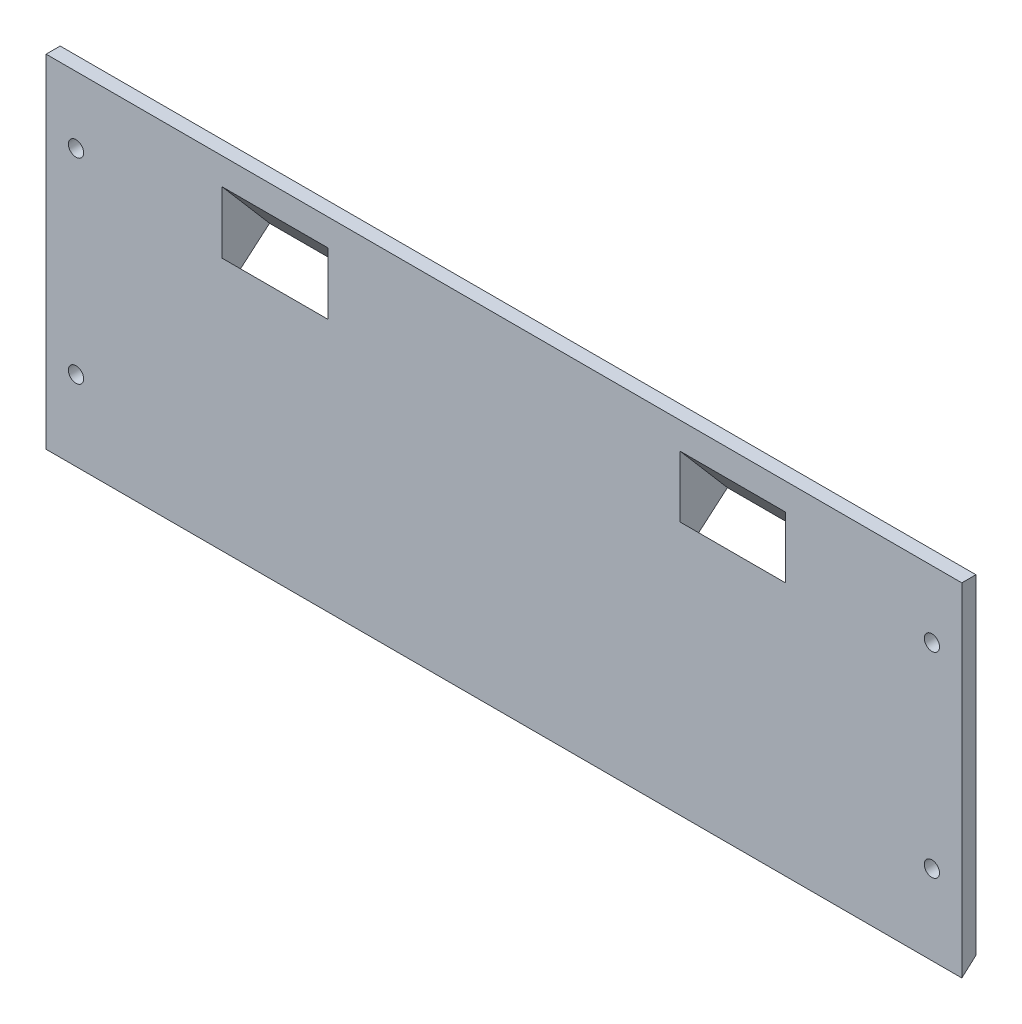
from build123d import *

# Parameters (mm, degrees)
CROQUIS1_W                  = 195
CROQUIS1_H                  = 38
CROQUIS1_R                  = 1.625
SALIENTE_EXTRUIR1_DEPTH     = 3
CROQUIS8_W                  = 195
CROQUIS8_H                  = 3
SALIENTE_EXTRUIR5_DEPTH     = 5
CROQUIS9_W                  = 195
CROQUIS9_H                  = 3
SALIENTE_EXTRUIR6_DEPTH     = 5
SALIENTE_EXTRUIR7_START     = -35
SALIENTE_EXTRUIR7_DEPTH     = 35
CORTAR_EXTRUIR4_DEPTH       = 106.249773968
CORTAR_EXTRUIR4_DEPTH_BACK  = 106.249773968
CROQUIS11_W                 = 22.5
CROQUIS11_H                 = 8.5
CORTAR_EXTRUIR5_REACH       = 168.049
CROQUIS13_R                 = 1
CORTAR_EXTRUIR6_DEPTH       = 5
SALIENTE_EXTRUIR8_START     = -35
SALIENTE_EXTRUIR8_DEPTH     = 35
CORTAR_EXTRUIR7_DEPTH       = 105.027363957
CORTAR_EXTRUIR7_DEPTH_BACK  = 105.027363957
CROQUIS16_W                 = 22.5
CROQUIS16_H                 = 8.572274099
CROQUIS17_R                 = 1
CORTAR_EXTRUIR8_DEPTH       = 5
CROQUIS18_R                 = 1.625
CORTAR_EXTRUIR9_DEPTH       = 10
CROQUIS19_W                 = 195
CROQUIS19_H                 = 24
SALIENTE_EXTRUIR9_DEPTH     = 3
CROQUIS20_W                 = 195
CROQUIS20_H                 = 28.69
SALIENTE_EXTRUIR10_DEPTH    = 3
CROQUIS22_W                 = 195
CROQUIS22_H                 = 8.799275258
CROQUIS22_W_2               = 10.817472397
CROQUIS22_H_2               = 9.408992843
CROQUIS22_W_3               = 11.057059306
SALIENTE_EXTRUIR11_DEPTH    = 3
CROQUIS23_R                 = 1.625
CORTAR_EXTRUIR10_DEPTH      = 10
CORTAR_EXTRUIR11_DEPTH      = 202.915168907
CORTAR_EXTRUIR11_DEPTH_BACK = 202.915168907
CROQUIS25_W                 = 6.04831912
CROQUIS25_H                 = 14.575165693
SALIENTE_EXTRUIR12_START    = -65
SALIENTE_EXTRUIR12_DEPTH    = 65
SALIENTE_EXTRUIR15_DEPTH    = 12.75
SALIENTE_EXTRUIR16_DEPTH    = 12.75
CROQUIS27_W                 = 3
CROQUIS27_H                 = 30
SALIENTE_EXTRUIR13_DEPTH    = 195
SALIENTE_EXTRUIR14_DEPTH    = 195
CORTAR_EXTRUIR12_DEPTH      = 127.00662353
CORTAR_EXTRUIR12_DEPTH_BACK = 127.00662353
CROQUIS31_R                 = 1.625
SALIENTE_EXTRUIR17_DEPTH    = 12.75
SALIENTE_EXTRUIR18_DEPTH    = 12.75
CORTAR_EXTRUIR15_DEPTH      = 125.603100021
CORTAR_EXTRUIR15_DEPTH_BACK = 125.603100021
CROQUIS39_R                 = 1.625
CORTAR_EXTRUIR16_START      = -4
CROQUIS40_R                 = 4
CORTAR_EXTRUIR16_DEPTH      = 121.603100021
SALIENTE_EXTRUIR19_START    = -15
SALIENTE_EXTRUIR19_DEPTH    = 4
CHAFL_N1_SIZE               = 10
CORTAR_EXTRUIR17_DEPTH      = 213.001339527
CORTAR_EXTRUIR17_DEPTH_BACK = 213.001339527
CROQUIS45_W                 = 3
CROQUIS45_H                 = 8.799275258
CORTAR_EXTRUIR18_DEPTH      = 202.915168907


with BuildPart() as part:
    # Croquis1 → Saliente-Extruir1 (new body)
    with BuildSketch(Plane.XY):
        with Locations((0, 19)):
            Rectangle(CROQUIS1_W, CROQUIS1_H)
        with Locations((91.125, 15)):
            Circle(CROQUIS1_R, mode=Mode.SUBTRACT)
        with Locations(Location((-91.125, 15, 0), (0, 0, 180))):
            Circle(CROQUIS1_R, mode=Mode.SUBTRACT)
    extrude(amount=SALIENTE_EXTRUIR1_DEPTH)

    # Croquis8 → Saliente-Extruir5 (add)
    with BuildSketch(Plane.XZ):
        with Locations((0, 1.5)):
            Rectangle(CROQUIS8_W, CROQUIS8_H)
    extrude(amount=SALIENTE_EXTRUIR5_DEPTH)

    # Croquis9 → Saliente-Extruir6 (add)
    with BuildSketch(Plane(origin=(0, 38, 0), x_dir=(1, 0, 0), z_dir=(0, 1, 0))):
        with Locations((0, -1.5)):
            Rectangle(CROQUIS9_W, CROQUIS9_H)
    extrude(amount=SALIENTE_EXTRUIR6_DEPTH)

    # Croquis10 → Saliente-Extruir7 (add)
    with BuildSketch(Plane(origin=(97.5, 0, 0), x_dir=(0, 0, -1), z_dir=(1, 0, 0)).offset(SALIENTE_EXTRUIR7_START)):
        Polygon((0, 35.316843742), (11.100559408, 22.365598856), (1.230032412, 13.905534031), (0, 12.851268747), align=None)
    extrude(amount=-SALIENTE_EXTRUIR7_DEPTH)

    # Croquis11 → Cortar-Extruir4 (cut, two sides: drawn at the far end of the back side and taken through both)
    with BuildSketch(Plane(origin=(0, 7.408665422, 6.349994257), x_dir=(1, 0, 0), z_dir=(0, -0.7592713073348797, -0.6507742172658522)).offset(-CORTAR_EXTRUIR4_DEPTH_BACK)):
        with Locations((48.75, -17.733291342)):
            Rectangle(CROQUIS11_W, CROQUIS11_H)
    extrude(amount=CORTAR_EXTRUIR4_DEPTH + CORTAR_EXTRUIR4_DEPTH_BACK, mode=Mode.SUBTRACT)

    # Croquis12 → Cortar-Extruir5 (cut, up to next)
    with BuildSketch(Plane(origin=(62.5, 0, 0), x_dir=(0, 0, -1), z_dir=(1, 0, 0)), mode=Mode.PRIVATE) as cortar_extruir5_sk1:
        Polygon((11.100559408, 22.365598856), (0, 12.851268747), (0, 19.436530105), (7.846688321, 26.161955392), align=None)
    cortar_extruir5_tool1 = extrude(cortar_extruir5_sk1.sketch, amount=-CORTAR_EXTRUIR5_REACH, mode=Mode.PRIVATE) & part.part
    add(cortar_extruir5_tool1.solids().sort_by_distance((62.5, 20.055266, -4.783378))[0], mode=Mode.SUBTRACT)

    # Croquis13 → Cortar-Extruir6 (cut)
    with BuildSketch(Plane(origin=(0, 11.205021959, 9.603865343), x_dir=(1, 0, 0), z_dir=(0, -0.7592713073348788, -0.6507742172658535))):
        with Locations(Location((33.75, -17.823291342, 0), (0, 0, 270))):
            Circle(CROQUIS13_R)
    extrude(amount=-CORTAR_EXTRUIR6_DEPTH, mode=Mode.SUBTRACT)

    # Croquis14 → Saliente-Extruir8 (add)
    with BuildSketch(Plane.ZY.offset(97.5).offset(SALIENTE_EXTRUIR8_START)):
        Polygon((0, 19.436530105), (-7.846688321, 26.161955392), (0, 35.316843742), align=None)
    extrude(amount=-SALIENTE_EXTRUIR8_DEPTH)

    # Croquis16 → Cortar-Extruir7 (cut, two sides: drawn at the far end of the back side and taken through both)
    with BuildSketch(Plane(origin=(0, 11.205021959, 9.603865343), x_dir=(1, 0, 0), z_dir=(0, -0.7592713073348788, -0.6507742172658535)).offset(-CORTAR_EXTRUIR7_DEPTH_BACK)):
        with Locations((-48.75, -17.697154293)):
            Rectangle(CROQUIS16_W, CROQUIS16_H)
    extrude(amount=CORTAR_EXTRUIR7_DEPTH + CORTAR_EXTRUIR7_DEPTH_BACK, mode=Mode.SUBTRACT)

    # Croquis17 → Cortar-Extruir8 (cut)
    with BuildSketch(Plane(origin=(0, 11.205021959, 9.603865343), x_dir=(1, 0, 0), z_dir=(0, -0.7592713073348788, -0.6507742172658535))):
        with Locations(Location((-33.75, -17.823291342, 0), (0, 0, 90))):
            Circle(CROQUIS17_R)
    extrude(amount=-CORTAR_EXTRUIR8_DEPTH, mode=Mode.SUBTRACT)

    # Croquis18 → Cortar-Extruir9 (cut)
    with BuildSketch(Plane.XY.offset(3)):
        with Locations((91.125, 23)):
            Circle(CROQUIS18_R)
        with Locations((-91.125, 23)):
            Circle(CROQUIS18_R)
    extrude(amount=-CORTAR_EXTRUIR9_DEPTH, mode=Mode.SUBTRACT)

    # Croquis19 → Saliente-Extruir9 (add)
    with BuildSketch(Plane.XY.offset(3)):
        with Locations((0, 7)):
            Rectangle(CROQUIS19_W, CROQUIS19_H)
    extrude(amount=-SALIENTE_EXTRUIR9_DEPTH)

    # Croquis20 → Saliente-Extruir10 (add)
    with BuildSketch(Plane.XY.offset(3)):
        with Locations((0, -19.345)):
            Rectangle(CROQUIS20_W, CROQUIS20_H)
    extrude(amount=-SALIENTE_EXTRUIR10_DEPTH)

    # Croquis22 → Saliente-Extruir11 (add)
    with BuildSketch(Plane.XY.offset(3)):
        with Locations((0, 47.399637629)):
            Rectangle(CROQUIS22_W, CROQUIS22_H)
        with Locations((-92.091263802, 22.840486177)):
            Rectangle(CROQUIS22_W_2, CROQUIS22_H_2)
        with Locations((91.971470347, 22.840486177)):
            Rectangle(CROQUIS22_W_3, CROQUIS22_H_2)
    extrude(amount=-SALIENTE_EXTRUIR11_DEPTH)

    # Croquis23 → Cortar-Extruir10 (cut)
    with BuildSketch(Plane.XY.offset(3)):
        with Locations((-91.125, 28.799275258)):
            Circle(CROQUIS23_R)
        with Locations((-91.125, -12.890724742)):
            Circle(CROQUIS23_R)
        with Locations((91.125, -12.890724742)):
            Circle(CROQUIS23_R)
        with Locations((91.125, 28.799275258)):
            Circle(CROQUIS23_R)
    extrude(amount=-CORTAR_EXTRUIR10_DEPTH, mode=Mode.SUBTRACT)

    # Croquis25 → Cortar-Extruir11 (cut, two sides: drawn at the far end of the back side and taken through both)
    with BuildSketch(Plane.ZY.offset(97.5).offset(-CORTAR_EXTRUIR11_DEPTH_BACK)):
        with Locations((3.02415956, -34.488307588)):
            Rectangle(CROQUIS25_W, CROQUIS25_H)
    extrude(amount=CORTAR_EXTRUIR11_DEPTH + CORTAR_EXTRUIR11_DEPTH_BACK, mode=Mode.SUBTRACT)

    # Croquis26 → Saliente-Extruir12 (add)
    with BuildSketch(Plane(origin=(97.5, 0, 0), x_dir=(0, 0, -1), z_dir=(1, 0, 0)).offset(SALIENTE_EXTRUIR12_START)):
        Polygon((0, 51.799275258), (0, 57.17304517), (3, 57.17304517), (3, 48.799275258), (0, 44.799275258), align=None)
    extrude(amount=-SALIENTE_EXTRUIR12_DEPTH)

    # Croquis29 → Saliente-Extruir15 (add)
    with BuildSketch(Plane(origin=(97.5, 0, 0), x_dir=(0, 0, -1), z_dir=(1, 0, 0))):
        Polygon((-3, -27.200724742), (21.04761885, -55.257563071), (22.868084319, -53.697235453), (-1.179534531, -25.640397124), align=None)
    extrude(amount=-SALIENTE_EXTRUIR15_DEPTH)

    # Croquis30 → Saliente-Extruir16 (add)
    with BuildSketch(Plane.ZY.offset(97.5)):
        Polygon((0, -27.200724742), (3, -27.200724742), (-21.04761885, -55.257563071), (-22.868084319, -53.697235453), align=None)
    extrude(amount=-SALIENTE_EXTRUIR16_DEPTH)

    # Croquis27 → Saliente-Extruir13 (add)
    with BuildSketch(Plane(origin=(97.5, 0, 0), x_dir=(0, 0, -1), z_dir=(1, 0, 0))):
        with Locations((-1.5, -42.200724742)):
            Rectangle(CROQUIS27_W, CROQUIS27_H)
    extrude(amount=-SALIENTE_EXTRUIR13_DEPTH)

    # Croquis28 → Saliente-Extruir14 (add)
    with BuildSketch(Plane(origin=(97.5, 0, 0), x_dir=(0, 0, -1), z_dir=(1, 0, 0))):
        Polygon((20.723276226, -76.378985981), (0, -52.200724742), (0, -57.200724742), (-3, -57.200724742), (16.523226518, -79.978863962), align=None)
        Polygon((0, -57.200724742), (0, -52.200724742), (-3, -54.772035726), (-3, -57.200724742), align=None)
    extrude(amount=-SALIENTE_EXTRUIR14_DEPTH)

    # Croquis31 → Cortar-Extruir12 (cut, two sides: drawn at the far end of the back side and taken through both)
    with BuildSketch(Plane(origin=(0, -13.002042132, 15.169742848), x_dir=(1, 0, 0), z_dir=(0, -0.6507742172658533, 0.7592713073348789)).offset(-CORTAR_EXTRUIR12_DEPTH_BACK)):
        with Locations(Location((91.125, -37.962916807, 0), (0, 0, 270))):
            Circle(CROQUIS31_R)
        with Locations(Location((-91.125, -37.962916807, 0), (0, 0, 270))):
            Circle(CROQUIS31_R)
    extrude(amount=CORTAR_EXTRUIR12_DEPTH + CORTAR_EXTRUIR12_DEPTH_BACK, mode=Mode.SUBTRACT)

    # Croquis32 → Saliente-Extruir17 (add)
    with BuildSketch(Plane(origin=(97.5, 0, 0), x_dir=(0, 0, -1), z_dir=(1, 0, 0))):
        Polygon((0, -30.7008848), (21.04761885, -55.257563071), (10.361638113, -64.289855362), (0, -52.200724742), align=None)
    extrude(amount=-SALIENTE_EXTRUIR17_DEPTH)

    # Croquis33 → Saliente-Extruir18 (add)
    with BuildSketch(Plane.ZY.offset(97.5)):
        Polygon((0, -30.7008848), (0, -52.200724742), (-10.361638113, -64.289855362), (-21.04761885, -55.257563071), align=None)
    extrude(amount=-SALIENTE_EXTRUIR18_DEPTH)

    # Croquis39 → Cortar-Extruir15 (cut, two sides: drawn at the far end of the back side and taken through both)
    with BuildSketch(Plane(origin=(0, -11.441714514, 13.349277379), x_dir=(-1, 0, 0), z_dir=(0, 0.6507742172658534, -0.7592713073348788)).offset(-CORTAR_EXTRUIR15_DEPTH_BACK)):
        with Locations(Location((91.125, -37.962916807, 0), (0, 0, 270))):
            Circle(CROQUIS39_R)
        with Locations(Location((-91.125, -37.962916807, 0), (0, 0, 270))):
            Circle(CROQUIS39_R)
    extrude(amount=CORTAR_EXTRUIR15_DEPTH + CORTAR_EXTRUIR15_DEPTH_BACK, mode=Mode.SUBTRACT)

    # Croquis40 → Cortar-Extruir16 (cut, through all)
    with BuildSketch(Plane(origin=(0, -11.441714514, 13.349277379), x_dir=(-1, 0, 0), z_dir=(0, 0.6507742172658534, -0.7592713073348788)).offset(CORTAR_EXTRUIR16_START)):
        with Locations(Location((-91.125, -37.962916807, 0), (0, 0, 90))):
            Circle(CROQUIS40_R)
        with Locations(Location((91.125, -37.962916807, 0), (0, 0, 90))):
            Circle(CROQUIS40_R)
    extrude(amount=-CORTAR_EXTRUIR16_DEPTH, mode=Mode.SUBTRACT)

    # Croquis43 → Saliente-Extruir19 (add)
    with BuildSketch(Plane(origin=(0, -54.271609374, -46.516395087), x_dir=(1, 0, 0), z_dir=(0, -0.7592713073348788, -0.6507742172658533)).offset(SALIENTE_EXTRUIR19_START)):
        with BuildLine():
            Line((-10, 33.970885785), (10, 33.970885785))
            Line((10, 33.970885785), (10, 23.970885785))
            Line((10, 23.970885785), (3.75, 23.970885785))
            Line((3.75, 23.970885785), (3.75, 28.970885785))
            ThreePointArc((3.75, 28.970885785), (0, 32.720885785), (-3.75, 28.970885785))
            Line((-3.75, 28.970885785), (-3.75, 23.970885785))
            Line((-3.75, 23.970885785), (-10, 23.970885785))
            Line((-10, 23.970885785), (-10, 33.970885785))
        make_face()
    extrude(amount=-SALIENTE_EXTRUIR19_DEPTH)

    # Chaflán1
    chafl_n1_edges = [part.edges().sort_by_distance(p)[0] for p in [
        (-10, -63.471373756, -9.660114532),
        (10, -63.471373756, -9.660114532),
    ]]
    chamfer(chafl_n1_edges, length=CHAFL_N1_SIZE - 0.0001)  # a hair under: the kernel refuses the full size

    # Croquis44 → Cortar-Extruir17 (cut, two sides: drawn at the far end of the back side and taken through both)
    with BuildSketch(Plane.ZY.offset(97.5).offset(-CORTAR_EXTRUIR17_DEPTH_BACK)):
        Polygon((0, 51.799275258), (0, 44.799275258), (-5.496499464, 48.299275258), (-4.805550045, 58.708716301), (3.346767107, 60.185775605), align=None)
        Polygon((0, -27.200724742), (19.940439733, -44.968243133), (-20.573128604, -90.43651563), (-48.007758083, -62.518842932), (0, -27.016583675), align=None)
    extrude(amount=CORTAR_EXTRUIR17_DEPTH + CORTAR_EXTRUIR17_DEPTH_BACK, mode=Mode.SUBTRACT)

    # Croquis45 → Cortar-Extruir18 (cut, through all)
    with BuildSketch(Plane.ZY.offset(97.5)):
        with Locations((1.5, 47.399637629)):
            Rectangle(CROQUIS45_W, CROQUIS45_H)
    extrude(amount=-CORTAR_EXTRUIR18_DEPTH, mode=Mode.SUBTRACT)


solid = part.part
